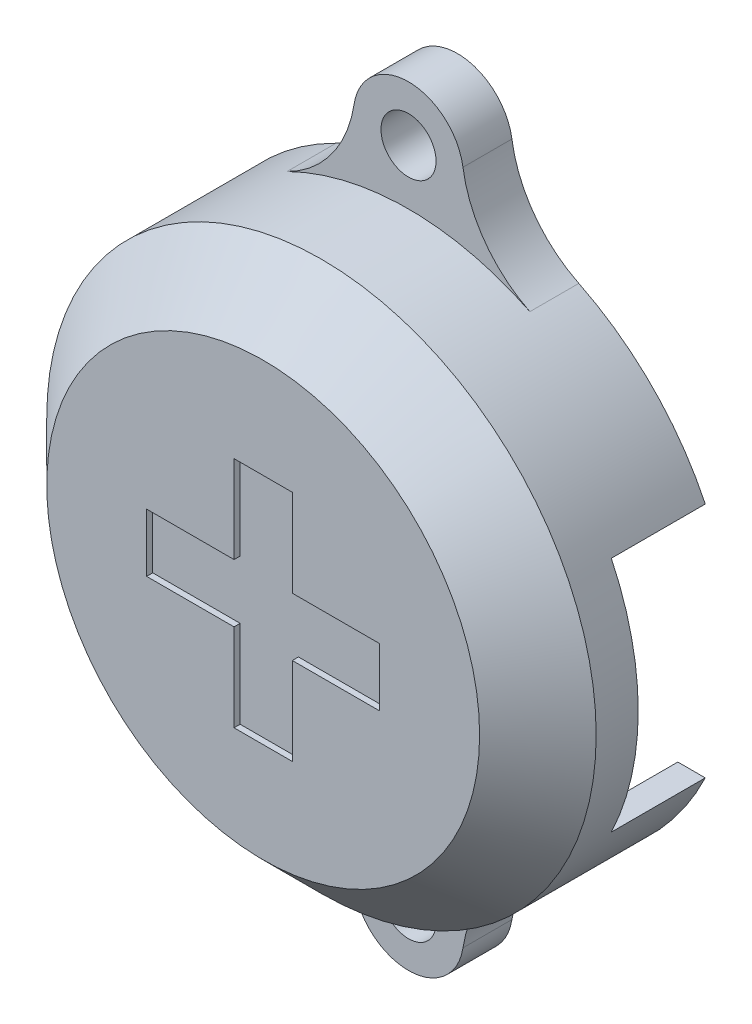
from build123d import *

# Parameters (mm, degrees)
SKETCH1_R               = 20.450000000000003
BOSS_EXTRUDE1_DEPTH     = 15.875
CUT_EXTRUDE2_START      = -11.875
CUT_EXTRUDE2_DEPTH      = 11.875
M4_CLEARANCE_HOLE1_D    = 4.5
CHAMFER1_SIZE           = 4.7625
SHELL1_OUTLINE_R        = 20.45
SHELL1_DEPTH            = 10.284072775
SHELL1_2_DEPTH          = 2
BOSS_EXTRUDE2_START     = 2
BOSS_EXTRUDE2_DEPTH     = 2
CUT_EXTRUDE5_DEPTH      = 0.5
CUT_EXTRUDE7_DEPTH      = 42.774640932046694
CUT_EXTRUDE7_DEPTH_BACK = 42.774640932046694


with BuildPart() as part:
    # Sketch1 → Boss-Extrude1 (new body)
    # profile 1 of 2: a face of its own
    with BuildSketch(Plane.XY):
        with BuildLine():
            ThreePointArc((-4.449768205772106, -27.620494530122933), (-6.26579346059064, -23.208178662106004), (-9.919608253272203, -20.139609532026952))
            ThreePointArc((-9.919608253272203, -20.139609532026952), (-22.449999999999612, -2.260939e-11), (-9.919608253272486, 20.139609531981904))
            ThreePointArc((-9.919608253272486, 20.139609531981904), (-6.265793460590954, 23.208178662061), (-4.449768205772483, 27.620494530077963))
            ThreePointArc((-4.449768205772483, 27.620494530077963), (1.6339e-13, 31.449999999977553), (4.449768205772869, 27.620494530078034))
            ThreePointArc((4.449768205772869, 27.620494530078034), (6.265793460591407, 23.2081786620611), (9.919608253272981, 20.139609531982046))
            ThreePointArc((9.919608253272981, 20.139609531982046), (22.4500000000004, -2.229809e-11), (9.919608253273257, -20.13960953202682))
            ThreePointArc((9.919608253273257, -20.13960953202682), (6.265793460591725, -23.20817866210592), (4.449768205773249, -27.620494530122876))
            ThreePointArc((4.449768205773249, -27.620494530122876), (5.9636e-13, -31.450000000022463), (-4.449768205772106, -27.620494530122933))
        make_face()
        Circle(SKETCH1_R, mode=Mode.SUBTRACT)
    # profile 2 of 2: a face of its own
    with BuildSketch(Plane.XY):
        Circle(SKETCH1_R)
    extrude(amount=BOSS_EXTRUDE1_DEPTH)

    # Sketch3 → Cut-Extrude2 (cut)
    with BuildSketch(Plane.XY.offset(15.875).offset(CUT_EXTRUDE2_START)):
        with BuildLine():
            ThreePointArc((-9.919608253272486, 20.139609531981908), (2.3162e-13, 22.449999999977553), (9.919608253272981, 20.13960953198205))
            ThreePointArc((9.91960825327298, 20.139609531982046), (6.2657934605914, 23.208178662061094), (4.4497682057728625, 27.620494530078037))
            ThreePointArc((4.4497682057728625, 27.620494530078037), (1.6065e-13, 31.449999999977546), (-4.449768205772477, 27.620494530077963))
            ThreePointArc((-4.449768205772479, 27.620494530077963), (-6.265793460590951, 23.208178662061), (-9.919608253272482, 20.139609531981904))
        make_face()
        with BuildLine():
            ThreePointArc((4.449768205773246, -27.62049453012288), (6.265793460591725, -23.20817866210592), (9.919608253273257, -20.13960953202682))
            ThreePointArc((9.919608253273244, -20.139609532026824), (5.4515e-13, -22.45000000002246), (-9.919608253272205, -20.139609532026956))
            ThreePointArc((-9.9196082532722, -20.139609532026952), (-6.265793460590633, -23.208178662106), (-4.449768205772095, -27.620494530122933))
            ThreePointArc((-4.4497682057720995, -27.620494530122933), (5.9608e-13, -31.450000000022456), (4.449768205773246, -27.62049453012288))
        make_face()
    extrude(amount=CUT_EXTRUDE2_DEPTH, mode=Mode.SUBTRACT)

    # M4 Clearance Hole1 (through all)
    with Locations(Plane.XY.offset(4)):
        with Locations((0, -26.95), (0, 26.95)):
            Hole(M4_CLEARANCE_HOLE1_D / 2)

    # Chamfer1
    chamfer1_edges = [part.edges().sort_by_distance(p)[0] for p in [
        (9.91960825327299, 20.139609531982046, 15.875),
    ]]
    chamfer(chamfer1_edges, length=CHAMFER1_SIZE)

    # Shell1: read off the stored shape, not the designer's step
    # Shell1 outline → Shell1 (cut)
    with BuildSketch(Plane.XY):
        Circle(SHELL1_OUTLINE_R)
    extrude(amount=SHELL1_DEPTH, mode=Mode.SUBTRACT)

    # Shell1 2 outline → Shell1 2 (cut)
    with BuildSketch(Plane.XY):
        with BuildLine():
            ThreePointArc((9.035901505, -18.345434963), (0, -20.45), (-9.035901505, -18.345434963))
            ThreePointArc((-9.035901505, -18.345434963), (-5.656595992, -20.826114024), (-3.336769132, -24.317800965))
            ThreePointArc((-3.336769132, -24.317800965), (0, -22.7), (3.336769132, -24.317800965))
            ThreePointArc((3.336769132, -24.317800965), (5.656595992, -20.826114024), (9.035901505, -18.345434963))
        make_face()
        with BuildLine():
            ThreePointArc((-3.336769132, 24.317800965), (-5.656595992, 20.826114024), (-9.035901505, 18.345434963))
            ThreePointArc((-9.035901505, 18.345434963), (0, 20.45), (9.035901505, 18.345434963))
            ThreePointArc((9.035901505, 18.345434963), (5.656595992, 20.826114024), (3.336769132, 24.317800965))
            ThreePointArc((3.336769132, 24.317800965), (0, 22.7), (-3.336769132, 24.317800965))
        make_face()
    extrude(amount=SHELL1_2_DEPTH, mode=Mode.SUBTRACT)

    # Shell1 3 outline → Shell1 3 (revolve, cut)
    with BuildSketch(Plane.XZ):
        Polygon((16.859072875, 13.875), (0, 13.875), (0, 10.284072775), (20.45, 10.284072775), align=None)
    revolve(axis=Axis((0, 0, 0), (0, 0, 1)), mode=Mode.SUBTRACT)

    # Sketch6 → Boss-Extrude2 (add)
    with BuildSketch(Plane(origin=(0, 0, 2), x_dir=(-1, 0, 0), z_dir=(0, 0, -1)).offset(BOSS_EXTRUDE2_START)):
        with BuildLine():
            ThreePointArc((9.035901504651038, -18.34543496347422), (5.656595991725949, -20.826114024149227), (3.3367691319005477, -24.3178009648972))
            ThreePointArc((3.3367691319005477, -24.3178009648972), (-5.6684e-13, -22.70000000000008), (-3.3367691319011485, -24.317800964898304))
            ThreePointArc((-3.3367691319011485, -24.317800964898304), (-5.656595991726578, -20.826114024149597), (-9.035901504652076, -18.345434963474087))
            ThreePointArc((-9.035901504652076, -18.345434963474087), (-5.3382e-13, -20.45000000002246), (9.035901504651038, -18.34543496347422))
        make_face()
        with BuildLine():
            ThreePointArc((-9.035901504651829, 18.345434963429298), (-5.65659599172108, 20.826114024110222), (-3.336769131894781, 24.31780096486728))
            ThreePointArc((-3.336769131894781, 24.31780096486728), (-2.2525e-13, 22.699999999977557), (3.336769131894348, 24.317800964867242))
            ThreePointArc((3.336769131894348, 24.317800964867242), (5.656595991720593, 20.826114024110154), (9.03590150465129, 18.345434963429177))
            ThreePointArc((9.03590150465129, 18.345434963429177), (-2.5229e-13, 20.449999999977546), (-9.035901504651829, 18.345434963429298))
        make_face()
    extrude(amount=-BOSS_EXTRUDE2_DEPTH)

    # Sketch7 → Cut-Extrude5 (cut)
    with BuildSketch(Plane.XY.offset(15.875)):
        Polygon((-2.381250000000002, 9.524999999999997), (-2.381250000000001, 2.3812500000000005), (2.3812499999999996, 2.3812500000000005), (2.3812499999999983, 9.524999999999997), align=None)
        Polygon((2.3812499999999996, 2.3812500000000005), (-2.3812500000000014, 2.3812500000000005), (-2.3812500000000005, -2.3812499999999996), (2.3812499999999996, -2.3812499999999996), align=None)
        Polygon((9.525, 2.3812500000000005), (2.3812499999999996, 2.3812500000000005), (2.381249999999999, -2.3812499999999996), (9.525, -2.3812499999999996), align=None)
        Polygon((-2.3812500000000014, 2.3812500000000005), (-9.525, 2.3812500000000005), (-9.525, -2.3812500000000005), (-2.3812500000000005, -2.38125), align=None)
        Polygon((2.3812499999999996, -2.3812499999999996), (-2.3812500000000005, -2.38125), (-2.3812499999999996, -9.525000000000004), (2.3812499999999996, -9.525000000000004), align=None)
    extrude(amount=-CUT_EXTRUDE5_DEPTH, mode=Mode.SUBTRACT)

    # Sketch9 → Cut-Extrude7 (cut, two sides: drawn at the far end of the back side and taken through both)
    # profile 1 of 3: a face of its own
    with BuildSketch(Plane(origin=(0, 0, 0), x_dir=(0, 0, -1), z_dir=(1, 0, 0)).offset(-CUT_EXTRUDE7_DEPTH_BACK)):
        Polygon((-1.5018000000013485, 9.688999997177131), (-1.5018000000013485, -9.68900000282286), (-7.676800000001349, -9.689000002822862), (-7.676800000001349, 9.688999997177131), align=None)
        Polygon((-3.0018000000013485, 8.188999997177131), (-6.176800000001349, 8.188999997177124), (-6.176800000001349, -8.189000002822862), (-3.0018000000013485, -8.189000002822862), align=None, mode=Mode.SUBTRACT)
    # profile 2 of 3: a face of its own
    with BuildSketch(Plane(origin=(0, 0, 0), x_dir=(0, 0, -1), z_dir=(1, 0, 0)).offset(-CUT_EXTRUDE7_DEPTH_BACK)):
        Polygon((0, -9.68900000282286), (-1.5018000000013485, -9.68900000282286), (-1.5018000000013485, 9.688999997177131), (0, 9.68899999717713), align=None)
    # profile 3 of 3: a face of its own
    with BuildSketch(Plane(origin=(0, 0, 0), x_dir=(0, 0, -1), z_dir=(1, 0, 0)).offset(-CUT_EXTRUDE7_DEPTH_BACK)):
        Polygon((-3.0018000000013485, 8.188999997177131), (-3.0018000000013485, -8.189000002822862), (-6.176800000001349, -8.189000002822862), (-6.176800000001349, 8.188999997177124), align=None)
    extrude(amount=CUT_EXTRUDE7_DEPTH + CUT_EXTRUDE7_DEPTH_BACK, mode=Mode.SUBTRACT)


solid = part.part
